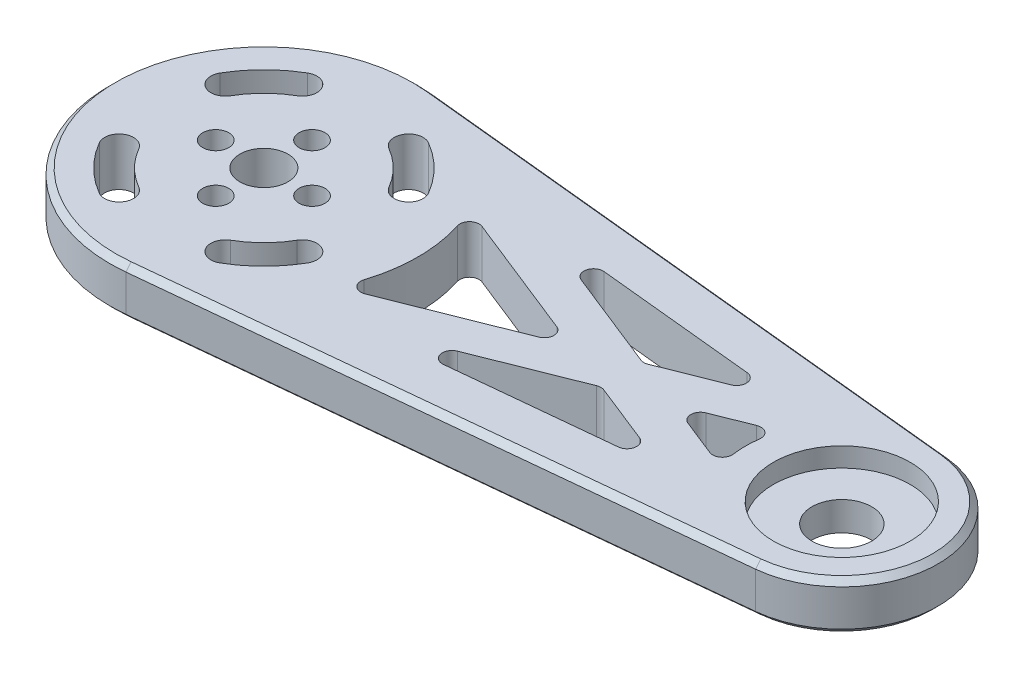
from build123d import *

# Parameters (mm, degrees)
SKETCH_1_R      = 1.35
SKETCH_1_R_2    = 2.5
SKETCH_1_R_3    = 7.1
EXTRUDE_1_DEPTH = 5
SKETCH_1_3_R    = 7.1
SKETCH_1_3_R_2  = 3.1
EXTRUDE_2_DEPTH = 3
FILLET_1_R      = 1
CHAMFER_1_SIZE  = 0.6


with BuildPart() as part:
    # 草图1 → 凸台-拉伸1 (new body)
    with BuildSketch(Plane(origin=(0, 0, 0), x_dir=(1, 0, 0), z_dir=(0, 1, 0))):
        with BuildLine():
            ThreePointArc((1.6, 15.919798994), (-16, 0), (1.6, -15.919798994))
            Line((1.6, -15.919798994), (61, -9.949874371))
            ThreePointArc((61, -9.949874371), (70, 0), (61, 9.949874371))
            Line((61, 9.949874371), (1.6, 15.919798994))
        make_face()
        with BuildLine():
            ThreePointArc((-6.268918397, -10.814372942), (-8.838834765, -8.838834765), (-10.814372942, -6.268918397))
            ThreePointArc((-10.814372942, -6.268918397), (-10.268918397, -4.218923436), (-8.218923436, -4.764377982))
            ThreePointArc((-8.218923436, -4.764377982), (-6.717514421, -6.717514421), (-4.764377982, -8.218923436))
            ThreePointArc((-4.764377982, -8.218923436), (-4.218923436, -10.268918397), (-6.268918397, -10.814372942))
        make_face(mode=Mode.SUBTRACT)
        with Locations((0, -5)):
            Circle(SKETCH_1_R, mode=Mode.SUBTRACT)
        with BuildLine():
            ThreePointArc((10.814372942, -6.268918397), (8.838834765, -8.838834765), (6.268918397, -10.814372942))
            ThreePointArc((6.268918397, -10.814372942), (4.218923436, -10.268918397), (4.764377982, -8.218923436))
            ThreePointArc((4.764377982, -8.218923436), (6.717514421, -6.717514421), (8.218923436, -4.764377982))
            ThreePointArc((8.218923436, -4.764377982), (10.268918397, -4.218923436), (10.814372942, -6.268918397))
        make_face(mode=Mode.SUBTRACT)
        with BuildLine():
            ThreePointArc((14.422056339, -6.928512895), (16, 0), (14.422056339, 6.928512895))
            Line((14.422056339, 6.928512895), (31.815454695, 0))
            Line((31.815454695, 0), (14.422056339, -6.928512895))
        make_face(mode=Mode.SUBTRACT)
        Polygon((47.567517096, -6.274700622), (19.888927579, -9.056503536), (37.219953316, -2.152836244), align=None, mode=Mode.SUBTRACT)
        with Locations((-5, 0)):
            Circle(SKETCH_1_R, mode=Mode.SUBTRACT)
        Circle(SKETCH_1_R_2, mode=Mode.SUBTRACT)
        with Locations((5, 0)):
            Circle(SKETCH_1_R, mode=Mode.SUBTRACT)
        with BuildLine():
            ThreePointArc((-10.814372942, 6.268918397), (-8.838834765, 8.838834765), (-6.268918397, 10.814372942))
            ThreePointArc((-6.268918397, 10.814372942), (-4.218923436, 10.268918397), (-4.764377982, 8.218923436))
            ThreePointArc((-4.764377982, 8.218923436), (-6.717514421, 6.717514421), (-8.218923436, 4.764377982))
            ThreePointArc((-8.218923436, 4.764377982), (-10.268918397, 4.218923436), (-10.814372942, 6.268918397))
        make_face(mode=Mode.SUBTRACT)
        with Locations((0, 5)):
            Circle(SKETCH_1_R, mode=Mode.SUBTRACT)
        with BuildLine():
            ThreePointArc((6.268918397, 10.814372942), (8.838834765, 8.838834765), (10.814372942, 6.268918397))
            ThreePointArc((10.814372942, 6.268918397), (10.268918397, 4.218923436), (8.218923436, 4.764377982))
            ThreePointArc((8.218923436, 4.764377982), (6.717514421, 6.717514421), (4.764377982, 8.218923436))
            ThreePointArc((4.764377982, 8.218923436), (4.218923436, 10.268918397), (6.268918397, 10.814372942))
        make_face(mode=Mode.SUBTRACT)
        with BuildLine():
            Line((50.505563121, -3.139373879), (42.624451937, 0))
            Line((42.624451937, 0), (50.505563121, 3.139373879))
            ThreePointArc((50.505563121, 3.139373879), (50, 0), (50.505563121, -3.139373879))
        make_face(mode=Mode.SUBTRACT)
        Polygon((37.219953316, 2.152836244), (19.888927579, 9.056503536), (47.567517096, 6.274700622), align=None, mode=Mode.SUBTRACT)
        with Locations((60, 0)):
            Circle(SKETCH_1_R_3, mode=Mode.SUBTRACT)
    extrude(amount=EXTRUDE_1_DEPTH)

    # 草图1<3> → 凸台-拉伸2 (add)
    with BuildSketch(Plane(origin=(0, 0, 0), x_dir=(1, 0, 0), z_dir=(0, 1, 0))):
        with Locations((60, 0)):
            Circle(SKETCH_1_3_R)
        with Locations((60, 0)):
            Circle(SKETCH_1_3_R_2, mode=Mode.SUBTRACT)
    extrude(amount=EXTRUDE_2_DEPTH)

    # 圆角1
    fillet_1_edges = [part.edges().sort_by_distance(p)[0] for p in [
        (42.624451937, 2.5, 0),
        (50.505563121, 2.5, -3.139373879),
        (50.505563121, 2.5, 3.139373879),
        (47.567517096, 2.5, -6.274700622),
        (19.888927579, 2.5, -9.056503536),
        (37.219953316, 2.5, -2.152836244),
        (31.815454695, 2.5, 0),
        (14.422056339, 2.5, -6.928512895),
        (14.422056339, 2.5, 6.928512895),
        (19.888927579, 2.5, 9.056503536),
        (37.219953316, 2.5, 2.152836244),
        (47.567517096, 2.5, 6.274700622),
    ]]
    fillet(fillet_1_edges, radius=FILLET_1_R)

    # 倒角1
    chamfer_1_edges = [part.edges().sort_by_distance(p)[0] for p in [
        (31.3, 5, 12.934836682),
        (-16, 5, 0),
        (70, 5, 0),
        (31.3, 5, -12.934836682),
        (31.3, 0, 12.934836682),
        (-16, 0, 0),
        (70, 0, 0),
        (31.3, 0, -12.934836682),
    ]]
    chamfer(chamfer_1_edges, length=CHAMFER_1_SIZE)


solid = part.part
